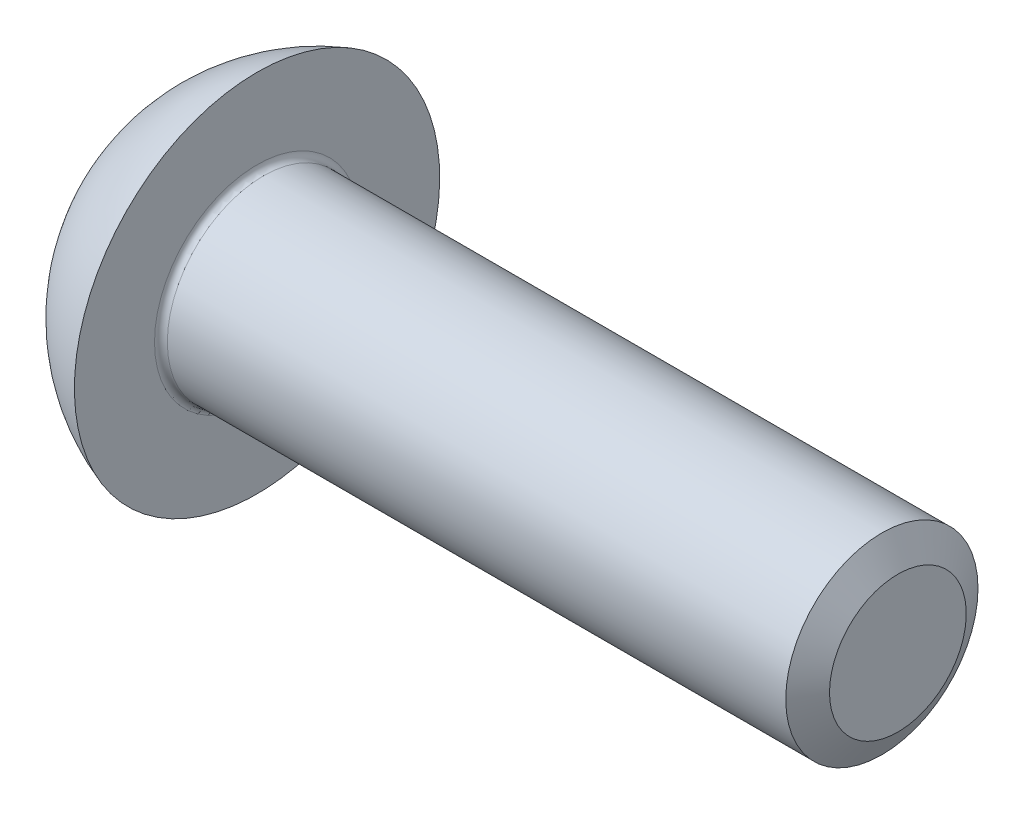
from build123d import *

# Parameters (mm, degrees)
CUT_EXTRUDE_1_DEPTH = 1.65


with BuildPart() as part:
    # 草图1 → 旋转1 (revolve)
    with BuildSketch(Plane.XY):
        with BuildLine():
            Line((0, 1.5), (-9.9, 1.5))
            ThreePointArc((-9.9, 1.5), (-9.970710678, 1.529289322), (-10, 1.6))
            Line((-10, 1.6), (-10, 2.85))
            ThreePointArc((-10, 2.85), (-10.948716751, 2.326209363), (-11.65, 1.5))
            Line((-11.65, 1.5), (-11.65, 0))
            Line((-11.65, 0), (0, 0))
            Line((0, 0), (0, 1.5))
        make_face()
    revolve(axis=Axis((-11.65, 0, 0), (1, 0, 0)))

    # 草图2 → 切除-拉伸1 (cut)
    with BuildSketch(Plane.ZY.offset(11.65)):
        Polygon((0, 1.154700538), (-1, 0.577350269), (-1, -0.577350269), (0, -1.154700538), (1, -0.577350269), (1, 0.577350269), align=None)
    extrude(amount=-CUT_EXTRUDE_1_DEPTH, mode=Mode.SUBTRACT)

    # 草图6 → 旋转2 (revolve)
    with BuildSketch(Plane.XY):
        Polygon((-10.61, 1.154700538), (-10, 0), (-9.7, 0), (-9.7, 1.154700538), align=None)
    revolve(axis=Axis((-11.65, 0, 0), (1, 0, 0)))

    # 草图7 → 切除-旋转5 (revolve, cut)
    with BuildSketch(Plane.XY):
        Polygon((-11.65, 1.154700538), (-11.35, 0), (-11.65, 0), align=None)
    revolve(axis=Axis((-11.65, 0, 0), (1, 0, 0)), mode=Mode.SUBTRACT)

    # 草图4 → 切除-旋转1 (revolve, cut)
    with BuildSketch(Plane.XY):
        Polygon((-0.25, 1.5), (0, 1.066987298), (0.25, 1.5), align=None)
    revolve(axis=Axis((-0.25, 0, 0), (1, 0, 0)), mode=Mode.SUBTRACT)


solid = part.part
